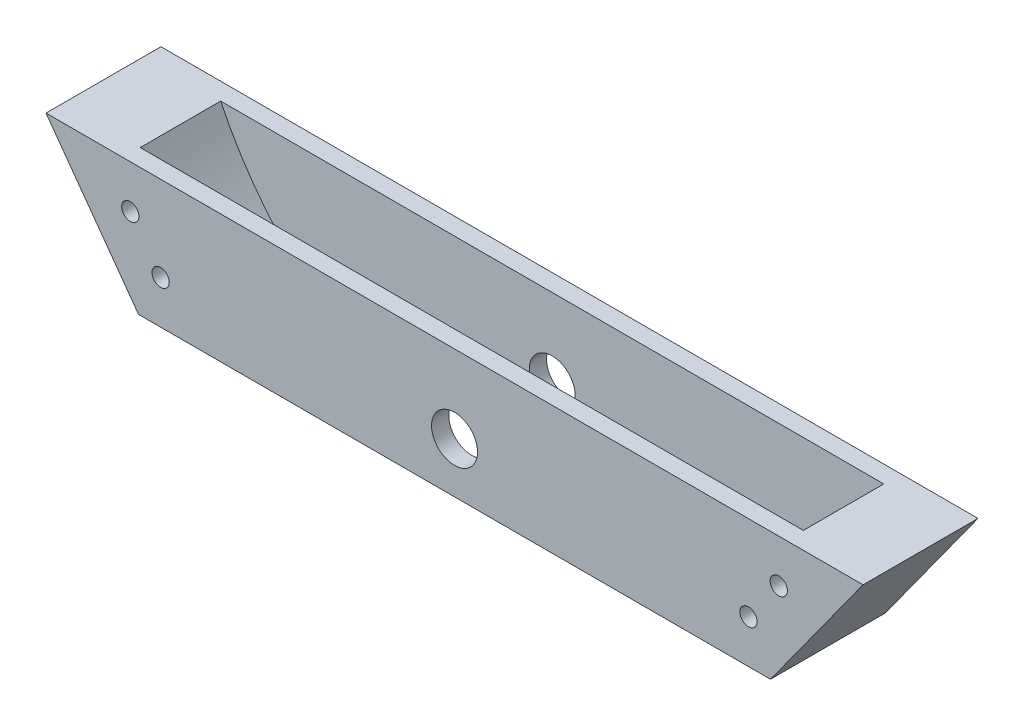
from build123d import *

# Parameters (mm, degrees)
SKETCH1_R             = 1.5
BOSS_EXTRUDE1_DEPTH   = 7
BOSS_EXTRUDE1_2_DEPTH = 7
SKETCH2_R             = 4
SKETCH2_R_2           = 1.5
BOSS_EXTRUDE2_DEPTH   = 3


with BuildPart() as part:
    # Sketch1 → Boss-Extrude1 (new, symmetric)
    with BuildSketch(Plane.XY):
        with BuildLine():
            Line((-57.692807239, -27.704512139), (-71.0874428, -27.704512139))
            Line((-71.0874428, -27.704512139), (-54.981120944, -50))
            Line((-54.981120944, -50), (-39.949968711, -50))
            ThreePointArc((-39.949968711, -50), (-50.077940438, -39.852225552), (-57.692807239, -27.704512139))
        make_face()
        with Locations((-51.14684741, -42.5)):
            Circle(SKETCH1_R, mode=Mode.SUBTRACT)
        with Locations((-56.417127941, -35.204512139)):
            Circle(SKETCH1_R, mode=Mode.SUBTRACT)
    extrude(amount=BOSS_EXTRUDE1_DEPTH, both=True)



with BuildPart() as body_2:
    # Sketch1 → Boss-Extrude1 2 (new, symmetric)
    with BuildSketch(Plane.XY):
        with BuildLine():
            Line((39.949968711, -50), (54.981120944, -50))
            Line((54.981120944, -50), (71.0874428, -27.704512139))
            Line((71.0874428, -27.704512139), (57.692807239, -27.704512139))
            ThreePointArc((57.692807239, -27.704512139), (50.077940438, -39.852225552), (39.949968711, -50))
        make_face()
        with Locations((51.14684741, -42.5)):
            Circle(SKETCH1_R, mode=Mode.SUBTRACT)
        with Locations((56.417127941, -35.204512139)):
            Circle(SKETCH1_R, mode=Mode.SUBTRACT)
    extrude(amount=BOSS_EXTRUDE1_2_DEPTH, both=True)


with BuildPart() as part_1:
    add(part.part)

    add(body_2.part)  # Boss-Extrude2 merges body 2
    # Sketch2 → Boss-Extrude2 (add)
    with BuildSketch(Plane.XY.offset(7)):
        Polygon((-54.981120944, -50), (54.981120944, -50), (71.0874428, -27.704512139), (-71.0874428, -27.704512139), align=None)
        with Locations((0, -41.25)):
            Circle(SKETCH2_R, mode=Mode.SUBTRACT)
        with Locations((56.417127941, -35.204512139)):
            Circle(SKETCH2_R_2, mode=Mode.SUBTRACT)
        with Locations((51.14684741, -42.5)):
            Circle(SKETCH2_R_2, mode=Mode.SUBTRACT)
        with Locations((-51.14684741, -42.5)):
            Circle(SKETCH2_R_2, mode=Mode.SUBTRACT)
        with Locations((-56.417127941, -35.204512139)):
            Circle(SKETCH2_R_2, mode=Mode.SUBTRACT)
    boss_extrude2 = extrude(amount=BOSS_EXTRUDE2_DEPTH)

    # Mirror2: Boss-Extrude2 across plane
    add(boss_extrude2.mirror(Plane.XY))


solid = part_1.part
